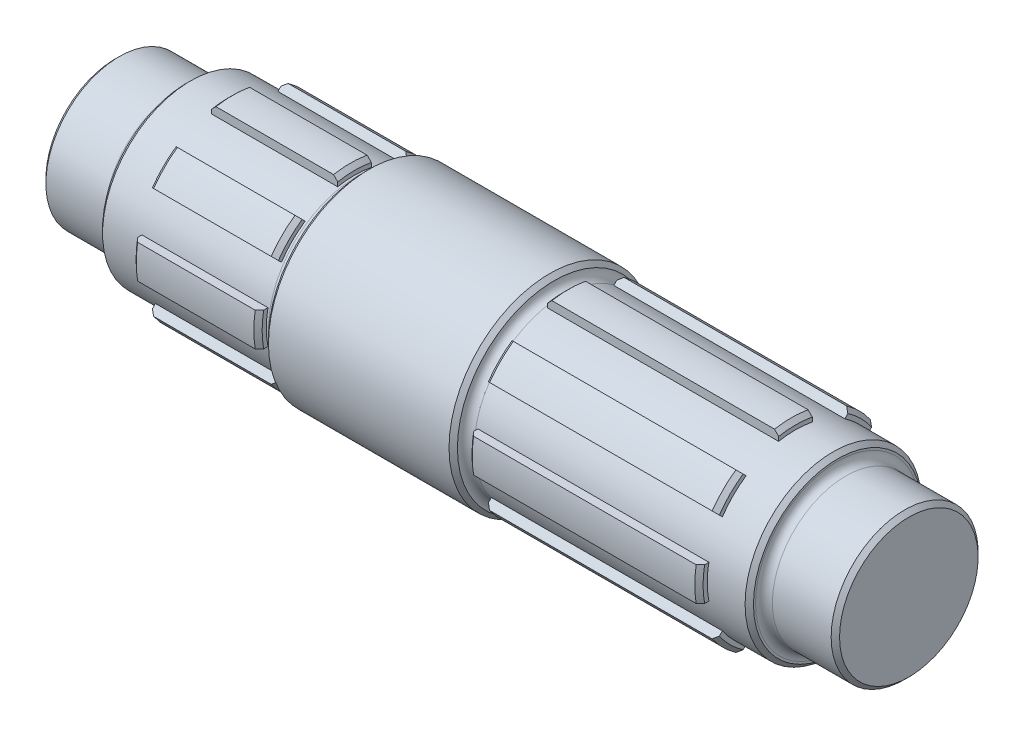
from build123d import *
from build123d.topology import SkipClean

# Parameters (mm, degrees)
CUT_EXTRUDE1_START = -30
CUT_EXTRUDE1_DEPTH = 30
CUT_EXTRUDE2_DEPTH = 55
FILLET1_R          = 2
CHAMFER1_SIZE      = 1


with BuildPart() as part:
    # Sketch1 → Revolve1 (revolve)
    with BuildSketch(Plane.XY, mode=Mode.PRIVATE) as revolve1_sk:
        Polygon((-105, 0), (-105, 17.5), (-88, 17.5), (-88, 21), (-78, 21), (-78, 23), (-48, 23), (-48, 21), (-45.5, 21), (-45.5, 24), (-0.5, 24), (-0.5, 21), (2, 21), (2, 23), (57, 23), (57, 21), (67, 21), (67, 17.5), (84, 17.5), (84, 0), align=None)
    revolve(revolve1_sk.sketch.rotate(Axis((-127.961783439, 0, 0), (1, 0, 0)), 90), axis=Axis((-127.961783439, 0, 0), (1, 0, 0)))

    # Sketch2 → Cut-Extrude1 (cut)
    with SkipClean():  # the faces are left unmerged after this step: merging them gives an invalid solid
        with BuildSketch(Plane.ZY.offset(78).offset(CUT_EXTRUDE1_START)):
            with BuildLine():
                Line((-4, 22.649503306), (-4, 20.615528128))
                ThreePointArc((-4, 20.615528128), (-8.03635208, 19.401470183), (-11.748952612, 17.405806862))
                Line((-11.748952612, 17.405806862), (-13.187190253, 18.844044503))
                ThreePointArc((-13.187190253, 18.844044503), (-8.801718944, 21.249229248), (-4, 22.649503306))
            make_face()
            with BuildLine():
                Line((4, 22.649503306), (4, 20.615528128))
                ThreePointArc((4, 20.615528128), (8.03635208, 19.401470183), (11.748952612, 17.405806862))
                Line((11.748952612, 17.405806862), (13.187190253, 18.844044503))
                ThreePointArc((13.187190253, 18.844044503), (8.801718944, 21.249229248), (4, 22.649503306))
            make_face()
            with BuildLine():
                Line((18.844044503, 13.187190253), (17.405806862, 11.748952612))
                ThreePointArc((17.405806862, 11.748952612), (19.401470183, 8.03635208), (20.615528128, 4))
                Line((20.615528128, 4), (22.649503306, 4))
                ThreePointArc((22.649503306, 4), (21.249229248, 8.801718944), (18.844044503, 13.187190253))
            make_face()
            with BuildLine():
                Line((22.649503306, -4), (20.615528128, -4))
                ThreePointArc((20.615528128, -4), (19.401470183, -8.03635208), (17.405806862, -11.748952612))
                Line((17.405806862, -11.748952612), (18.844044503, -13.187190253))
                ThreePointArc((18.844044503, -13.187190253), (21.249229248, -8.801718944), (22.649503306, -4))
            make_face()
            with BuildLine():
                Line((13.187190253, -18.844044503), (11.748952612, -17.405806862))
                ThreePointArc((11.748952612, -17.405806862), (8.03635208, -19.401470183), (4, -20.615528128))
                Line((4, -20.615528128), (4, -22.649503306))
                ThreePointArc((4, -22.649503306), (8.801718944, -21.249229248), (13.187190253, -18.844044503))
            make_face()
            with BuildLine():
                Line((-4, -22.649503306), (-4, -20.615528128))
                ThreePointArc((-4, -20.615528128), (-8.03635208, -19.401470183), (-11.748952612, -17.405806862))
                Line((-11.748952612, -17.405806862), (-13.187190253, -18.844044503))
                ThreePointArc((-13.187190253, -18.844044503), (-8.801718944, -21.249229248), (-4, -22.649503306))
            make_face()
            with BuildLine():
                Line((-18.844044503, -13.187190253), (-17.405806862, -11.748952612))
                ThreePointArc((-17.405806862, -11.748952612), (-19.401470183, -8.03635208), (-20.615528128, -4))
                Line((-20.615528128, -4), (-22.649503306, -4))
                ThreePointArc((-22.649503306, -4), (-21.249229248, -8.801718944), (-18.844044503, -13.187190253))
            make_face()
            with BuildLine():
                Line((-22.649503306, 4), (-20.615528128, 4))
                ThreePointArc((-20.615528128, 4), (-19.401470183, 8.03635208), (-17.405806862, 11.748952612))
                Line((-17.405806862, 11.748952612), (-18.844044503, 13.187190253))
                ThreePointArc((-18.844044503, 13.187190253), (-21.249229248, 8.801718944), (-22.649503306, 4))
            make_face()
        extrude(amount=CUT_EXTRUDE1_DEPTH, mode=Mode.SUBTRACT)

    # Sketch3 → Cut-Extrude2 (cut)
    with SkipClean():  # the faces are left unmerged after this step: merging them gives an invalid solid
        with BuildSketch(Plane(origin=(57, 0, 0), x_dir=(0, 0, -1), z_dir=(1, 0, 0))):
            with BuildLine():
                Line((-11.748952612, -17.405806862), (-13.187190253, -18.844044503))
                ThreePointArc((-13.187190253, -18.844044503), (-8.801718944, -21.249229248), (-4, -22.649503306))
                Line((-4, -22.649503306), (-4, -20.615528128))
                ThreePointArc((-4, -20.615528128), (-8.03635208, -19.401470183), (-11.748952612, -17.405806862))
            make_face()
            with BuildLine():
                Line((-20.615528128, -4), (-22.649503306, -4))
                ThreePointArc((-22.649503306, -4), (-21.249229248, -8.801718944), (-18.844044503, -13.187190253))
                Line((-18.844044503, -13.187190253), (-17.405806862, -11.748952612))
                ThreePointArc((-17.405806862, -11.748952612), (-19.401470183, -8.03635208), (-20.615528128, -4))
            make_face()
            with BuildLine():
                Line((-17.405806862, 11.748952612), (-18.844044503, 13.187190253))
                ThreePointArc((-18.844044503, 13.187190253), (-21.249229248, 8.801718944), (-22.649503306, 4))
                Line((-22.649503306, 4), (-20.615528128, 4))
                ThreePointArc((-20.615528128, 4), (-19.401470183, 8.03635208), (-17.405806862, 11.748952612))
            make_face()
            with BuildLine():
                Line((-13.187190253, 18.844044503), (-11.748952612, 17.405806862))
                ThreePointArc((-11.748952612, 17.405806862), (-8.03635208, 19.401470183), (-4, 20.615528128))
                Line((-4, 20.615528128), (-4, 22.649503306))
                ThreePointArc((-4, 22.649503306), (-8.801718944, 21.249229248), (-13.187190253, 18.844044503))
            make_face()
            with BuildLine():
                Line((11.748952612, 17.405806862), (13.187190253, 18.844044503))
                ThreePointArc((13.187190253, 18.844044503), (8.801718944, 21.249229248), (4, 22.649503306))
                Line((4, 22.649503306), (4, 20.615528128))
                ThreePointArc((4, 20.615528128), (8.03635208, 19.401470183), (11.748952612, 17.405806862))
            make_face()
            with BuildLine():
                Line((20.615528128, 4), (22.649503306, 4))
                ThreePointArc((22.649503306, 4), (21.249229248, 8.801718944), (18.844044503, 13.187190253))
                Line((18.844044503, 13.187190253), (17.405806862, 11.748952612))
                ThreePointArc((17.405806862, 11.748952612), (19.401470183, 8.03635208), (20.615528128, 4))
            make_face()
            with BuildLine():
                Line((17.405806862, -11.748952612), (18.844044503, -13.187190253))
                ThreePointArc((18.844044503, -13.187190253), (21.249229248, -8.801718944), (22.649503306, -4))
                Line((22.649503306, -4), (20.615528128, -4))
                ThreePointArc((20.615528128, -4), (19.401470183, -8.03635208), (17.405806862, -11.748952612))
            make_face()
            with BuildLine():
                Line((13.187190253, -18.844044503), (11.748952612, -17.405806862))
                ThreePointArc((11.748952612, -17.405806862), (8.03635208, -19.401470183), (4, -20.615528128))
                Line((4, -20.615528128), (4, -22.649503306))
                ThreePointArc((4, -22.649503306), (8.801718944, -21.249229248), (13.187190253, -18.844044503))
            make_face()
        extrude(amount=-CUT_EXTRUDE2_DEPTH, mode=Mode.SUBTRACT)

    # Fillet1
    fillet1_edges = [part.edges().sort_by_distance(p)[0] for p in [
        (67, 0, -17.5),
        (-0.5, 0, -21),
        (-45.5, 0, -21),
        (-88, 0, -17.5),
    ]]
    fillet(fillet1_edges, radius=FILLET1_R)

    # Chamfer1
    chamfer1_edges = [part.edges().sort_by_distance(p)[0] for p in [
        (84, 0, -17.5),
        (67, 0, -21),
        (57, 16.263455967, 16.263455967),
        (57, 23, 0),
        (57, 16.263455967, -16.263455967),
        (57, 0, -23),
        (57, -16.263455967, -16.263455967),
        (57, -23, 0),
        (57, -16.263455967, 16.263455967),
        (57, -2.007663314, 22.912208275),
        (2, 16.263455967, 16.263455967),
        (2, 23, 0),
        (2, 16.263455967, -16.263455967),
        (2, 0, -23),
        (2, -16.263455967, -16.263455967),
        (2, -23, 0),
        (2, -16.263455967, 16.263455967),
        (2, -2.007663314, 22.912208275),
        (-0.5, 0, -24),
        (-45.5, 0, -24),
        (-88, 0, -21),
        (-105, 0, -17.5),
        (-48, 16.263455967, 16.263455967),
        (-48, 23, 0),
        (-48, 16.263455967, -16.263455967),
        (-48, 0, -23),
        (-48, -16.263455967, -16.263455967),
        (-48, -23, 0),
        (-48, -16.263455967, 16.263455967),
        (-48, -2.007663314, 22.912208275),
        (-78, 16.263455967, 16.263455967),
        (-78, 23, 0),
        (-78, 16.263455967, -16.263455967),
        (-78, 0, -23),
        (-78, -16.263455967, -16.263455967),
        (-78, -23, 0),
        (-78, -16.263455967, 16.263455967),
        (-78, -2.007663314, 22.912208275),
    ]]
    chamfer(chamfer1_edges, length=CHAMFER1_SIZE - 0.0001)  # a hair under: the kernel refuses the full size


solid = part.part
